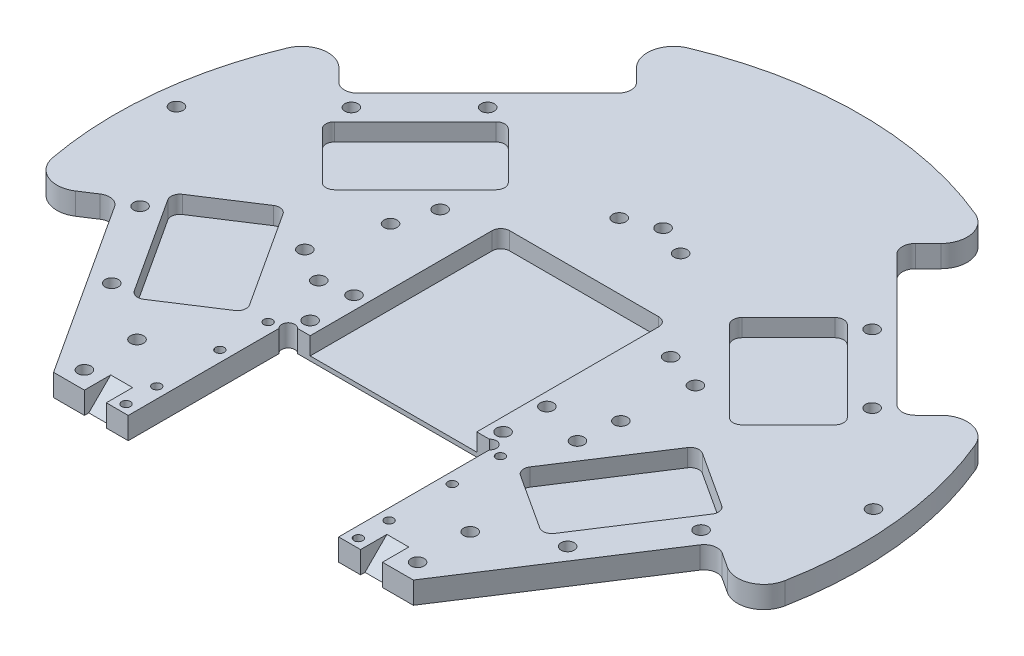
from build123d import *

# Parameters (mm, degrees)
SKETCH1_R            = 85
BOSS_EXTRUDE1_DEPTH  = 5
CUT_EXTRUDE1_REACH   = 122.312
SKETCH2_R            = 1.5
CUT_EXTRUDE2_DEPTH   = 4
FILLET2_R            = 2
FILLET3_R            = 6
FILLET4_R            = 3
FILLET2_OF_MIRROR1_R = 2
FILLET3_OF_MIRROR1_R = 6
FILLET4_OF_MIRROR1_R = 3
MIRROR2_START        = 1
MIRROR2_OUTLINE_R    = 1.5
MIRROR2_DEPTH        = 4
MIRROR2_2_OUTLINE_R  = 1.5
MIRROR2_2_DEPTH      = 1
CUT_EXTRUDE3_REACH   = 122.312
CUT_EXTRUDE4_REACH   = 122.312
SKETCH5_R            = 1.5
CUT_EXTRUDE5_REACH   = 122.312
SKETCH6_R            = 1.5
CUT_EXTRUDE6_REACH   = 122.312
SKETCH7_R            = 1.5
CUT_EXTRUDE7_REACH   = 122.312
SKETCH8_R            = 1
SKETCH8_R_2          = 1.5
CUT_EXTRUDE8_START   = -5
CUT_EXTRUDE8_DEPTH   = 5
CUT_EXTRUDE9_DEPTH   = 4
CUT_EXTRUDE10_REACH  = 122.312
SKETCH11_R           = 1.5


# Read off the part's stored shape, not the designer's step: Mirror2
with BuildPart() as part:
    # Sketch1 → Boss-Extrude1 (new body)
    with BuildSketch(Plane(origin=(0, 0, 0), x_dir=(1, 0, 0), z_dir=(0, 1, 0))):
        with Locations(Location((0, 0, 0), (0, 0, 270))):
            Circle(SKETCH1_R)
    extrude(amount=BOSS_EXTRUDE1_DEPTH)

    # Sketch2 → Cut-Extrude1 (cut, up to next)
    with BuildSketch(Plane(origin=(0, 5, 0), x_dir=(1, 0, 0), z_dir=(0, 1, 0)), mode=Mode.PRIVATE) as cut_extrude1_sk1:
        with Locations(Location((-59.39696962, 28.284271247, 0), (0, 0, 270))):
            Circle(SKETCH2_R)
    cut_extrude1_tool1 = extrude(cut_extrude1_sk1.sketch, amount=-CUT_EXTRUDE1_REACH, mode=Mode.PRIVATE) & part.part
    # Sketch2 → Cut-Extrude1 (cut, up to next)
    with BuildSketch(Plane(origin=(0, 5, 0), x_dir=(1, 0, 0), z_dir=(0, 1, 0)), mode=Mode.PRIVATE) as cut_extrude1_sk2:
        with Locations(Location((-43.840620434, 43.840620434, 0), (0, 0, 270))):
            Circle(SKETCH2_R)
    cut_extrude1_tool2 = extrude(cut_extrude1_sk2.sketch, amount=-CUT_EXTRUDE1_REACH, mode=Mode.PRIVATE) & part.part
    # Sketch2 → Cut-Extrude1 (cut, up to next)
    with BuildSketch(Plane(origin=(0, 5, 0), x_dir=(1, 0, 0), z_dir=(0, 1, 0)), mode=Mode.PRIVATE) as cut_extrude1_sk3:
        with BuildLine():
            Line((-40.687914512, 74.629040009), (-29.69848481, 63.639610307))
            Line((-29.69848481, 63.639610307), (-63.639610307, 29.69848481))
            Line((-63.639610307, 29.69848481), (-74.629040009, 40.687914512))
            ThreePointArc((-74.629040009, 40.687914512), (-60.104076401, 60.104076401), (-40.687914512, 74.629040009))
        make_face()
    cut_extrude1_tool3 = extrude(cut_extrude1_sk3.sketch, amount=-CUT_EXTRUDE1_REACH, mode=Mode.PRIVATE) & part.part
    cut_extrude1_1 = cut_extrude1_tool1.solids().sort_by_distance((-59.39697, 5, -28.284271))[0]
    add(cut_extrude1_1, mode=Mode.SUBTRACT)
    cut_extrude1_2 = cut_extrude1_tool2.solids().sort_by_distance((-43.84062, 5, -43.84062))[0]
    add(cut_extrude1_2, mode=Mode.SUBTRACT)
    cut_extrude1_3 = cut_extrude1_tool3.solids().sort_by_distance((-53.003264, 5, -53.003264))[0]
    add(cut_extrude1_3, mode=Mode.SUBTRACT)
    cut_extrude1 = cut_extrude1_1 + cut_extrude1_2 + cut_extrude1_3  # Cut-Extrude1 as one shape, for the pattern or mirror that repeats it

    # Sketch3 → Cut-Extrude2 (cut)
    with BuildSketch(Plane(origin=(0, 5, 0), x_dir=(1, 0, 0), z_dir=(0, 1, 0))):
        Polygon((-59.877802231, 22.146584387), (-38.664598795, 43.359787822), (-25.229569953, 29.92475898), (-46.442773388, 8.711555544), align=None)
    cut_extrude2 = extrude(amount=-CUT_EXTRUDE2_DEPTH, mode=Mode.SUBTRACT)

    # Fillet2
    fillet2_edges = [part.edges().sort_by_distance(p)[0] for p in [
        (-46.442773388, 3, -8.711555544),
        (-59.877802231, 3, -22.146584387),
        (-38.664598795, 3, -43.359787822),
        (-25.229569953, 3, -29.92475898),
    ]]
    fillet(fillet2_edges, radius=FILLET2_R)

    # Fillet3
    fillet3_edges = [part.edges().sort_by_distance(p)[0] for p in [
        (-40.687914512, 2.5, -74.629040009),
        (-74.629040009, 2.5, -40.687914512),
    ]]
    fillet(fillet3_edges, radius=FILLET3_R)

    # Fillet4
    fillet4_edges = [part.edges().sort_by_distance(p)[0] for p in [
        (-29.69848481, 2.5, -63.639610307),
        (-63.639610307, 2.5, -29.69848481),
    ]]
    fillet(fillet4_edges, radius=FILLET4_R)

    # Mirror1: Cut-Extrude1, Cut-Extrude2 across plane
    add(cut_extrude1.mirror(Plane(origin=(0, 0, 0), x_dir=(0.9945218953682733, 0, 0.10452846326765369), z_dir=(-0.10452846326765369, 0, 0.9945218953682733))), mode=Mode.SUBTRACT)
    add(cut_extrude2.mirror(Plane(origin=(0, 0, 0), x_dir=(0.9945218953682733, 0, 0.10452846326765369), z_dir=(-0.10452846326765369, 0, 0.9945218953682733))), mode=Mode.SUBTRACT)

    # Fillet2 of Mirror1
    fillet2_of_mirror1_edges = [part.edges().sort_by_distance(p)[0] for p in [
        (-47.239121604, 3, -1.134808387),
        (-63.173862395, 3, 9.213333278),
        (-46.834691345, 3, 34.373450316),
        (-30.899950554, 3, 24.025308651),
    ]]
    fillet(fillet2_of_mirror1_edges, radius=FILLET2_OF_MIRROR1_R)

    # Fillet3 of Mirror1
    fillet3_of_mirror1_edges = [part.edges().sort_by_distance(p)[0] for p in [
        (-55.315035851, 2.5, 64.538723328),
        (-81.457709532, 2.5, 24.282536066),
    ]]
    fillet(fillet3_of_mirror1_edges, radius=FILLET3_OF_MIRROR1_R)

    # Fillet4 of Mirror1
    fillet4_of_mirror1_edges = [part.edges().sort_by_distance(p)[0] for p in [
        (-42.280920644, 2.5, 56.074269942),
        (-68.423594325, 2.5, 15.81808268),
    ]]
    fillet(fillet4_of_mirror1_edges, radius=FILLET4_OF_MIRROR1_R)

    # Mirror2 outline → Mirror2 (cut)
    with BuildSketch(Plane(origin=(0, 0, 0), x_dir=(1, 0, 0), z_dir=(0, 1, 0)).offset(MIRROR2_START)):
        with BuildLine():
            ThreePointArc((43.914837749, -53.558258238), (43.496406651, -55.815910416), (44.796932348, -57.708187047))
            Line((44.796932348, -57.708187047), (48.220507685, -59.931482867))
            ThreePointArc((48.220507685, -59.931482867), (50.952027138, -64.875440225), (48.366800574, -69.89744346))
            ThreePointArc((48.366800574, -69.89744346), (71.286998275, -46.294317976), (83.527042075, -15.755419453))
            ThreePointArc((83.527042075, -15.755419453), (79.990720206, -20.159774174), (74.363181366, -19.675295605))
            Line((74.363181366, -19.675295605), (70.939606029, -17.451999785))
            ThreePointArc((70.939606029, -17.451999785), (68.681953851, -17.033568687), (66.78967722, -18.334094384))
            Line((66.78967722, -18.334094384), (43.914837749, -53.558258238))
        make_face()
        with BuildLine():
            ThreePointArc((68.647443459, 34.706317962), (74.051278315, 36.350240628), (78.426039904, 32.777374283))
            ThreePointArc((78.426039904, 32.777374283), (60.1040764, 60.1040764), (32.777374283, 78.426039904))
            ThreePointArc((32.777374283, 78.426039904), (36.350240628, 74.051278315), (34.706317962, 68.647443459))
            Line((34.706317962, 68.647443459), (31.819805153, 65.76093065))
            ThreePointArc((31.819805153, 65.76093065), (30.941125497, 63.639610307), (31.819805153, 61.518289963))
            Line((31.819805153, 61.518289963), (61.518289963, 31.819805153))
            ThreePointArc((61.518289963, 31.819805153), (63.639610307, 30.941125497), (65.76093065, 31.819805153))
            Line((65.76093065, 31.819805153), (68.647443459, 34.706317962))
        make_face()
        with Locations((63.979633983, -15.316867676)):
            Circle(MIRROR2_OUTLINE_R)
        with Locations((51.997575213, -33.767620171)):
            Circle(MIRROR2_OUTLINE_R)
        with BuildLine():
            ThreePointArc((62.084584325, -10.890674414), (62.363538391, -9.385572962), (61.496521259, -8.124055208))
            Line((61.496521259, -8.124055208), (48.91646274, 0.045530317))
            ThreePointArc((48.91646274, 0.045530317), (47.411361288, 0.324484383), (46.149843534, -0.542532749))
            Line((46.149843534, -0.542532749), (31.989228624, -22.347967515))
            ThreePointArc((31.989228624, -22.347967515), (31.710274558, -23.853068967), (32.57729169, -25.114586721))
            Line((32.57729169, -25.114586721), (45.157350209, -33.284172246))
            ThreePointArc((45.157350209, -33.284172246), (46.66245166, -33.563126312), (47.923969415, -32.696109181))
            Line((47.923969415, -32.696109181), (62.084584325, -10.890674414))
        make_face()
        with Locations((59.39696962, 28.284271247)):
            Circle(MIRROR2_OUTLINE_R)
        with Locations((43.840620434, 43.840620434)):
            Circle(MIRROR2_OUTLINE_R)
        with BuildLine():
            Line((47.856986951, 10.125769107), (58.463588669, 20.732370824))
            ThreePointArc((58.463588669, 20.732370824), (59.049375106, 22.146584387), (58.463588669, 23.560797949))
            Line((58.463588669, 23.560797949), (40.078812358, 41.94557426))
            ThreePointArc((40.078812358, 41.94557426), (38.664598796, 42.531360698), (37.250385233, 41.94557426))
            Line((37.250385233, 41.94557426), (26.643783515, 31.338972542))
            ThreePointArc((26.643783515, 31.338972542), (26.057997077, 29.924758979), (26.643783515, 28.510545417))
            Line((26.643783515, 28.510545417), (45.028559826, 10.125769107))
            ThreePointArc((45.028559826, 10.125769107), (46.442773389, 9.539982669), (47.856986951, 10.125769107))
        make_face()
    extrude(amount=MIRROR2_DEPTH, mode=Mode.SUBTRACT)

    # Mirror2 2 outline → Mirror2 2 (cut)
    with BuildSketch(Plane(origin=(0, 0, 0), x_dir=(1, 0, 0), z_dir=(0, 1, 0))):
        with BuildLine():
            ThreePointArc((43.914837749, -53.558258238), (43.496406651, -55.815910416), (44.796932348, -57.708187047))
            Line((44.796932348, -57.708187047), (48.220507685, -59.931482867))
            ThreePointArc((48.220507685, -59.931482867), (50.952027138, -64.875440225), (48.366800574, -69.89744346))
            ThreePointArc((48.366800574, -69.89744346), (71.286998275, -46.294317976), (83.527042075, -15.755419453))
            ThreePointArc((83.527042075, -15.755419453), (79.990720206, -20.159774174), (74.363181366, -19.675295605))
            Line((74.363181366, -19.675295605), (70.939606029, -17.451999785))
            ThreePointArc((70.939606029, -17.451999785), (68.681953851, -17.033568687), (66.78967722, -18.334094384))
            Line((66.78967722, -18.334094384), (43.914837749, -53.558258238))
        make_face()
        with BuildLine():
            ThreePointArc((68.647443459, 34.706317962), (74.051278315, 36.350240628), (78.426039904, 32.777374283))
            ThreePointArc((78.426039904, 32.777374283), (60.1040764, 60.1040764), (32.777374283, 78.426039904))
            ThreePointArc((32.777374283, 78.426039904), (36.350240628, 74.051278315), (34.706317962, 68.647443459))
            Line((34.706317962, 68.647443459), (31.819805153, 65.76093065))
            ThreePointArc((31.819805153, 65.76093065), (30.941125497, 63.639610307), (31.819805153, 61.518289963))
            Line((31.819805153, 61.518289963), (61.518289963, 31.819805153))
            ThreePointArc((61.518289963, 31.819805153), (63.639610307, 30.941125497), (65.76093065, 31.819805153))
            Line((65.76093065, 31.819805153), (68.647443459, 34.706317962))
        make_face()
        with Locations((63.979633983, -15.316867676)):
            Circle(MIRROR2_2_OUTLINE_R)
        with Locations((51.997575213, -33.767620171)):
            Circle(MIRROR2_2_OUTLINE_R)
        with Locations((59.39696962, 28.284271247)):
            Circle(MIRROR2_2_OUTLINE_R)
        with Locations((43.840620434, 43.840620434)):
            Circle(MIRROR2_2_OUTLINE_R)
    extrude(amount=MIRROR2_2_DEPTH, mode=Mode.SUBTRACT)

    # Sketch4 → Cut-Extrude3 (cut, up to next)
    with BuildSketch(Plane(origin=(0, 5, 0), x_dir=(1, 0, 0), z_dir=(0, 1, 0)), mode=Mode.PRIVATE) as cut_extrude3_sk1:
        Polygon((-43.914837749, -53.558258238), (-41.030336922, -58), (-24, -58), (-24, -21.5), (24, -21.5), (24, -58), (41.030336922, -58), (43.914837749, -53.558258238), (50.952673475, -58.128682198), (50.952673475, -85), (-50.952673475, -85), (-50.952673475, -58.128682198), align=None)
    cut_extrude3_tool1 = extrude(cut_extrude3_sk1.sketch, amount=-CUT_EXTRUDE3_REACH, mode=Mode.PRIVATE) & part.part
    add(cut_extrude3_tool1.solids().sort_by_distance((0, 5, 59.123155))[0], mode=Mode.SUBTRACT)

    # Sketch5 → Cut-Extrude4 (cut, up to next)
    with BuildSketch(Plane(origin=(0, 5, 0), x_dir=(1, 0, 0), z_dir=(0, 1, 0)), mode=Mode.PRIVATE) as cut_extrude4_sk1:
        with Locations((-23, -22.5)):
            Circle(SKETCH5_R)
    cut_extrude4_tool1 = extrude(cut_extrude4_sk1.sketch, amount=-CUT_EXTRUDE4_REACH, mode=Mode.PRIVATE) & part.part
    # Sketch5 → Cut-Extrude4 (cut, up to next)
    with BuildSketch(Plane(origin=(0, 5, 0), x_dir=(1, 0, 0), z_dir=(0, 1, 0)), mode=Mode.PRIVATE) as cut_extrude4_sk2:
        with Locations((23, -22.5)):
            Circle(SKETCH5_R)
    cut_extrude4_tool2 = extrude(cut_extrude4_sk2.sketch, amount=-CUT_EXTRUDE4_REACH, mode=Mode.PRIVATE) & part.part
    add(cut_extrude4_tool1.solids().sort_by_distance((-23, 5, 22.5))[0], mode=Mode.SUBTRACT)
    add(cut_extrude4_tool2.solids().sort_by_distance((23, 5, 22.5))[0], mode=Mode.SUBTRACT)

    # Sketch6 → Cut-Extrude5 (cut, up to next)
    with BuildSketch(Plane(origin=(0, 5, 0), x_dir=(1, 0, 0), z_dir=(0, 1, 0)), mode=Mode.PRIVATE) as cut_extrude5_sk1:
        with Locations(Location((-29.118657249, 18.25749709, 0), (0, 0, 270))):
            Circle(SKETCH6_R)
    cut_extrude5_tool1 = extrude(cut_extrude5_sk1.sketch, amount=-CUT_EXTRUDE5_REACH, mode=Mode.PRIVATE) & part.part
    # Sketch6 → Cut-Extrude5 (cut, up to next)
    with BuildSketch(Plane(origin=(0, 5, 0), x_dir=(1, 0, 0), z_dir=(0, 1, 0)), mode=Mode.PRIVATE) as cut_extrude5_sk2:
        with Locations(Location((-31.947084374, 9.772215716, 0), (0, 0, 270))):
            Circle(SKETCH6_R)
    cut_extrude5_tool2 = extrude(cut_extrude5_sk2.sketch, amount=-CUT_EXTRUDE5_REACH, mode=Mode.PRIVATE) & part.part
    # Sketch6 → Cut-Extrude5 (cut, up to next)
    with BuildSketch(Plane(origin=(0, 5, 0), x_dir=(1, 0, 0), z_dir=(0, 1, 0)), mode=Mode.PRIVATE) as cut_extrude5_sk3:
        with Locations(Location((-36.635404095, -5.095053168, 0), (0, 0, 270))):
            Circle(SKETCH6_R)
    cut_extrude5_tool3 = extrude(cut_extrude5_sk3.sketch, amount=-CUT_EXTRUDE5_REACH, mode=Mode.PRIVATE) & part.part
    # Sketch6 → Cut-Extrude5 (cut, up to next)
    with BuildSketch(Plane(origin=(0, 5, 0), x_dir=(1, 0, 0), z_dir=(0, 1, 0)), mode=Mode.PRIVATE) as cut_extrude5_sk4:
        with Locations(Location((-28.923609543, -9.625861571, 0), (0, 0, 270))):
            Circle(SKETCH6_R)
    cut_extrude5_tool4 = extrude(cut_extrude5_sk4.sketch, amount=-CUT_EXTRUDE5_REACH, mode=Mode.PRIVATE) & part.part
    # Sketch6 → Cut-Extrude5 (cut, up to next)
    with BuildSketch(Plane(origin=(0, 5, 0), x_dir=(1, 0, 0), z_dir=(0, 1, 0)), mode=Mode.PRIVATE) as cut_extrude5_sk5:
        with Locations(Location((33.280721823, -2.916497028, 0), (0, 0, 270))):
            Circle(SKETCH6_R)
    cut_extrude5_tool5 = extrude(cut_extrude5_sk5.sketch, amount=-CUT_EXTRUDE5_REACH, mode=Mode.PRIVATE) & part.part
    # Sketch6 → Cut-Extrude5 (cut, up to next)
    with BuildSketch(Plane(origin=(0, 5, 0), x_dir=(1, 0, 0), z_dir=(0, 1, 0)), mode=Mode.PRIVATE) as cut_extrude5_sk6:
        with Locations(Location((32.278291815, -11.804417711, 0), (0, 0, 270))):
            Circle(SKETCH6_R)
    cut_extrude5_tool6 = extrude(cut_extrude5_sk6.sketch, amount=-CUT_EXTRUDE5_REACH, mode=Mode.PRIVATE) & part.part
    # Sketch6 → Cut-Extrude5 (cut, up to next)
    with BuildSketch(Plane(origin=(0, 5, 0), x_dir=(1, 0, 0), z_dir=(0, 1, 0)), mode=Mode.PRIVATE) as cut_extrude5_sk7:
        with Locations(Location((26.290230125, 15.429069965, 0), (0, 0, 270))):
            Circle(SKETCH6_R)
    cut_extrude5_tool7 = extrude(cut_extrude5_sk7.sketch, amount=-CUT_EXTRUDE5_REACH, mode=Mode.PRIVATE) & part.part
    # Sketch6 → Cut-Extrude5 (cut, up to next)
    with BuildSketch(Plane(origin=(0, 5, 0), x_dir=(1, 0, 0), z_dir=(0, 1, 0)), mode=Mode.PRIVATE) as cut_extrude5_sk8:
        with Locations(Location((34.775511499, 12.600642841, 0), (0, 0, 270))):
            Circle(SKETCH6_R)
    cut_extrude5_tool8 = extrude(cut_extrude5_sk8.sketch, amount=-CUT_EXTRUDE5_REACH, mode=Mode.PRIVATE) & part.part
    add(cut_extrude5_tool1.solids().sort_by_distance((-29.118657, 5, -18.257497))[0], mode=Mode.SUBTRACT)
    add(cut_extrude5_tool2.solids().sort_by_distance((-31.947084, 5, -9.772216))[0], mode=Mode.SUBTRACT)
    add(cut_extrude5_tool3.solids().sort_by_distance((-36.635404, 5, 5.095053))[0], mode=Mode.SUBTRACT)
    add(cut_extrude5_tool4.solids().sort_by_distance((-28.92361, 5, 9.625862))[0], mode=Mode.SUBTRACT)
    add(cut_extrude5_tool5.solids().sort_by_distance((33.280722, 5, 2.916497))[0], mode=Mode.SUBTRACT)
    add(cut_extrude5_tool6.solids().sort_by_distance((32.278292, 5, 11.804418))[0], mode=Mode.SUBTRACT)
    add(cut_extrude5_tool7.solids().sort_by_distance((26.29023, 5, -15.42907))[0], mode=Mode.SUBTRACT)
    add(cut_extrude5_tool8.solids().sort_by_distance((34.775511, 5, -12.600643))[0], mode=Mode.SUBTRACT)

    # Sketch7 → Cut-Extrude6 (cut, up to next)
    with BuildSketch(Plane(origin=(0, 5, 0), x_dir=(1, 0, 0), z_dir=(0, 1, 0)), mode=Mode.PRIVATE) as cut_extrude6_sk1:
        with Locations(Location((0, 40, 0), (0, 0, 270))):
            Circle(SKETCH7_R)
    cut_extrude6_tool1 = extrude(cut_extrude6_sk1.sketch, amount=-CUT_EXTRUDE6_REACH, mode=Mode.PRIVATE) & part.part
    # Sketch7 → Cut-Extrude6 (cut, up to next)
    with BuildSketch(Plane(origin=(0, 5, 0), x_dir=(1, 0, 0), z_dir=(0, 1, 0)), mode=Mode.PRIVATE) as cut_extrude6_sk2:
        with Locations(Location((7, 37, 0), (0, 0, 270))):
            Circle(SKETCH7_R)
    cut_extrude6_tool2 = extrude(cut_extrude6_sk2.sketch, amount=-CUT_EXTRUDE6_REACH, mode=Mode.PRIVATE) & part.part
    # Sketch7 → Cut-Extrude6 (cut, up to next)
    with BuildSketch(Plane(origin=(0, 5, 0), x_dir=(1, 0, 0), z_dir=(0, 1, 0)), mode=Mode.PRIVATE) as cut_extrude6_sk3:
        with Locations(Location((-7, 37, 0), (0, 0, 270))):
            Circle(SKETCH7_R)
    cut_extrude6_tool3 = extrude(cut_extrude6_sk3.sketch, amount=-CUT_EXTRUDE6_REACH, mode=Mode.PRIVATE) & part.part
    # Sketch7 → Cut-Extrude6 (cut, up to next)
    with BuildSketch(Plane(origin=(0, 5, 0), x_dir=(1, 0, 0), z_dir=(0, 1, 0)), mode=Mode.PRIVATE) as cut_extrude6_sk4:
        with Locations(Location((-22, -8.5, 0), (0, 0, 270))):
            Circle(SKETCH7_R)
    cut_extrude6_tool4 = extrude(cut_extrude6_sk4.sketch, amount=-CUT_EXTRUDE6_REACH, mode=Mode.PRIVATE) & part.part
    # Sketch7 → Cut-Extrude6 (cut, up to next)
    with BuildSketch(Plane(origin=(0, 5, 0), x_dir=(1, 0, 0), z_dir=(0, 1, 0)), mode=Mode.PRIVATE) as cut_extrude6_sk5:
        with Locations(Location((-22, -18.5, 0), (0, 0, 270))):
            Circle(SKETCH7_R)
    cut_extrude6_tool5 = extrude(cut_extrude6_sk5.sketch, amount=-CUT_EXTRUDE6_REACH, mode=Mode.PRIVATE) & part.part
    # Sketch7 → Cut-Extrude6 (cut, up to next)
    with BuildSketch(Plane(origin=(0, 5, 0), x_dir=(1, 0, 0), z_dir=(0, 1, 0)), mode=Mode.PRIVATE) as cut_extrude6_sk6:
        with Locations(Location((22, -18.5, 0), (0, 0, 270))):
            Circle(SKETCH7_R)
    cut_extrude6_tool6 = extrude(cut_extrude6_sk6.sketch, amount=-CUT_EXTRUDE6_REACH, mode=Mode.PRIVATE) & part.part
    # Sketch7 → Cut-Extrude6 (cut, up to next)
    with BuildSketch(Plane(origin=(0, 5, 0), x_dir=(1, 0, 0), z_dir=(0, 1, 0)), mode=Mode.PRIVATE) as cut_extrude6_sk7:
        with Locations(Location((22, -8.5, 0), (0, 0, 270))):
            Circle(SKETCH7_R)
    cut_extrude6_tool7 = extrude(cut_extrude6_sk7.sketch, amount=-CUT_EXTRUDE6_REACH, mode=Mode.PRIVATE) & part.part
    add(cut_extrude6_tool1.solids().sort_by_distance((0, 5, -40))[0], mode=Mode.SUBTRACT)
    add(cut_extrude6_tool2.solids().sort_by_distance((7, 5, -37))[0], mode=Mode.SUBTRACT)
    add(cut_extrude6_tool3.solids().sort_by_distance((-7, 5, -37))[0], mode=Mode.SUBTRACT)
    add(cut_extrude6_tool4.solids().sort_by_distance((-22, 5, 8.5))[0], mode=Mode.SUBTRACT)
    add(cut_extrude6_tool5.solids().sort_by_distance((-22, 5, 18.5))[0], mode=Mode.SUBTRACT)
    add(cut_extrude6_tool6.solids().sort_by_distance((22, 5, 18.5))[0], mode=Mode.SUBTRACT)
    add(cut_extrude6_tool7.solids().sort_by_distance((22, 5, 8.5))[0], mode=Mode.SUBTRACT)

    # Sketch8 → Cut-Extrude7 (cut, up to next)
    with BuildSketch(Plane(origin=(0, 5, 0), x_dir=(1, 0, 0), z_dir=(0, 1, 0)), mode=Mode.PRIVATE) as cut_extrude7_sk1:
        with Locations(Location((-26.5, -23.6, 0), (0, 0, 270))):
            Circle(SKETCH8_R)
    cut_extrude7_tool1 = extrude(cut_extrude7_sk1.sketch, amount=-CUT_EXTRUDE7_REACH, mode=Mode.PRIVATE) & part.part
    # Sketch8 → Cut-Extrude7 (cut, up to next)
    with BuildSketch(Plane(origin=(0, 5, 0), x_dir=(1, 0, 0), z_dir=(0, 1, 0)), mode=Mode.PRIVATE) as cut_extrude7_sk2:
        with Locations(Location((-26.5, -34.6, 0), (0, 0, 270))):
            Circle(SKETCH8_R)
    cut_extrude7_tool2 = extrude(cut_extrude7_sk2.sketch, amount=-CUT_EXTRUDE7_REACH, mode=Mode.PRIVATE) & part.part
    # Sketch8 → Cut-Extrude7 (cut, up to next)
    with BuildSketch(Plane(origin=(0, 5, 0), x_dir=(1, 0, 0), z_dir=(0, 1, 0)), mode=Mode.PRIVATE) as cut_extrude7_sk3:
        with Locations(Location((-26.5, -49, 0), (0, 0, 270))):
            Circle(SKETCH8_R)
    cut_extrude7_tool3 = extrude(cut_extrude7_sk3.sketch, amount=-CUT_EXTRUDE7_REACH, mode=Mode.PRIVATE) & part.part
    # Sketch8 → Cut-Extrude7 (cut, up to next)
    with BuildSketch(Plane(origin=(0, 5, 0), x_dir=(1, 0, 0), z_dir=(0, 1, 0)), mode=Mode.PRIVATE) as cut_extrude7_sk4:
        with Locations(Location((-26.5, -56, 0), (0, 0, 270))):
            Circle(SKETCH8_R)
    cut_extrude7_tool4 = extrude(cut_extrude7_sk4.sketch, amount=-CUT_EXTRUDE7_REACH, mode=Mode.PRIVATE) & part.part
    # Sketch8 → Cut-Extrude7 (cut, up to next)
    with BuildSketch(Plane(origin=(0, 5, 0), x_dir=(1, 0, 0), z_dir=(0, 1, 0)), mode=Mode.PRIVATE) as cut_extrude7_sk5:
        with Locations(Location((-38, -54, 0), (0, 0, 270))):
            Circle(SKETCH8_R_2)
    cut_extrude7_tool5 = extrude(cut_extrude7_sk5.sketch, amount=-CUT_EXTRUDE7_REACH, mode=Mode.PRIVATE) & part.part
    # Sketch8 → Cut-Extrude7 (cut, up to next)
    with BuildSketch(Plane(origin=(0, 5, 0), x_dir=(1, 0, 0), z_dir=(0, 1, 0)), mode=Mode.PRIVATE) as cut_extrude7_sk6:
        with Locations(Location((-38, -42, 0), (0, 0, 270))):
            Circle(SKETCH8_R_2)
    cut_extrude7_tool6 = extrude(cut_extrude7_sk6.sketch, amount=-CUT_EXTRUDE7_REACH, mode=Mode.PRIVATE) & part.part
    cut_extrude7_1 = cut_extrude7_tool1.solids().sort_by_distance((-26.5, 5, 23.6))[0]
    add(cut_extrude7_1, mode=Mode.SUBTRACT)
    cut_extrude7_2 = cut_extrude7_tool2.solids().sort_by_distance((-26.5, 5, 34.6))[0]
    add(cut_extrude7_2, mode=Mode.SUBTRACT)
    cut_extrude7_3 = cut_extrude7_tool3.solids().sort_by_distance((-26.5, 5, 49))[0]
    add(cut_extrude7_3, mode=Mode.SUBTRACT)
    cut_extrude7_4 = cut_extrude7_tool4.solids().sort_by_distance((-26.5, 5, 56))[0]
    add(cut_extrude7_4, mode=Mode.SUBTRACT)
    cut_extrude7_5 = cut_extrude7_tool5.solids().sort_by_distance((-38, 5, 54))[0]
    add(cut_extrude7_5, mode=Mode.SUBTRACT)
    cut_extrude7_6 = cut_extrude7_tool6.solids().sort_by_distance((-38, 5, 42))[0]
    add(cut_extrude7_6, mode=Mode.SUBTRACT)
    cut_extrude7 = cut_extrude7_1 + cut_extrude7_2 + cut_extrude7_3 + cut_extrude7_4 + cut_extrude7_5 + cut_extrude7_6  # Cut-Extrude7 as one shape, for the pattern or mirror that repeats it

    # Mirror3: Cut-Extrude7 across plane
    add(cut_extrude7.mirror(Plane(origin=(0, 0, 0), x_dir=(0, 0, 1), z_dir=(1, 0, 0))), mode=Mode.SUBTRACT)

    # Sketch9 → Cut-Extrude8 (cut)
    with BuildSketch(Plane(origin=(-24, 0, 0), x_dir=(0, 0, -1), z_dir=(1, 0, 0)).offset(CUT_EXTRUDE8_START)):
        Polygon((-52, 5), (-57, 0), (-58, 0), (-58, 5), align=None)
    cut_extrude8 = extrude(amount=-CUT_EXTRUDE8_DEPTH, mode=Mode.SUBTRACT)

    # Mirror4: Cut-Extrude8 across plane
    add(cut_extrude8.mirror(Plane(origin=(0, 0, 0), x_dir=(0, 0, 1), z_dir=(1, 0, 0))), mode=Mode.SUBTRACT)

    # Sketch10 → Cut-Extrude9 (cut)
    with BuildSketch(Plane(origin=(0, 5, 0), x_dir=(1, 0, 0), z_dir=(0, 1, 0))):
        with BuildLine():
            Line((-19, -21.5), (19, -21.5))
            Line((19, -21.5), (19, 20))
            ThreePointArc((19, 20), (18.414213562, 21.414213562), (17, 22))
            Line((17, 22), (-17, 22))
            ThreePointArc((-17, 22), (-18.414213562, 21.414213562), (-19, 20))
            Line((-19, 20), (-19, -21.5))
        make_face()
    extrude(amount=-CUT_EXTRUDE9_DEPTH, mode=Mode.SUBTRACT)

    # Sketch11 → Cut-Extrude10 (cut, up to next)
    with BuildSketch(Plane(origin=(0, 5, 0), x_dir=(1, 0, 0), z_dir=(0, 1, 0)), mode=Mode.PRIVATE) as cut_extrude10_sk1:
        with Locations(Location((-79.5, 8.5, 0), (0, 0, 270))):
            Circle(SKETCH11_R)
    cut_extrude10_tool1 = extrude(cut_extrude10_sk1.sketch, amount=-CUT_EXTRUDE10_REACH, mode=Mode.PRIVATE) & part.part
    # Sketch11 → Cut-Extrude10 (cut, up to next)
    with BuildSketch(Plane(origin=(0, 5, 0), x_dir=(1, 0, 0), z_dir=(0, 1, 0)), mode=Mode.PRIVATE) as cut_extrude10_sk2:
        with Locations(Location((79.5, 8.5, 0), (0, 0, 270))):
            Circle(SKETCH11_R)
    cut_extrude10_tool2 = extrude(cut_extrude10_sk2.sketch, amount=-CUT_EXTRUDE10_REACH, mode=Mode.PRIVATE) & part.part
    add(cut_extrude10_tool1.solids().sort_by_distance((-79.5, 5, -8.5))[0], mode=Mode.SUBTRACT)
    add(cut_extrude10_tool2.solids().sort_by_distance((79.5, 5, -8.5))[0], mode=Mode.SUBTRACT)


solid = part.part
